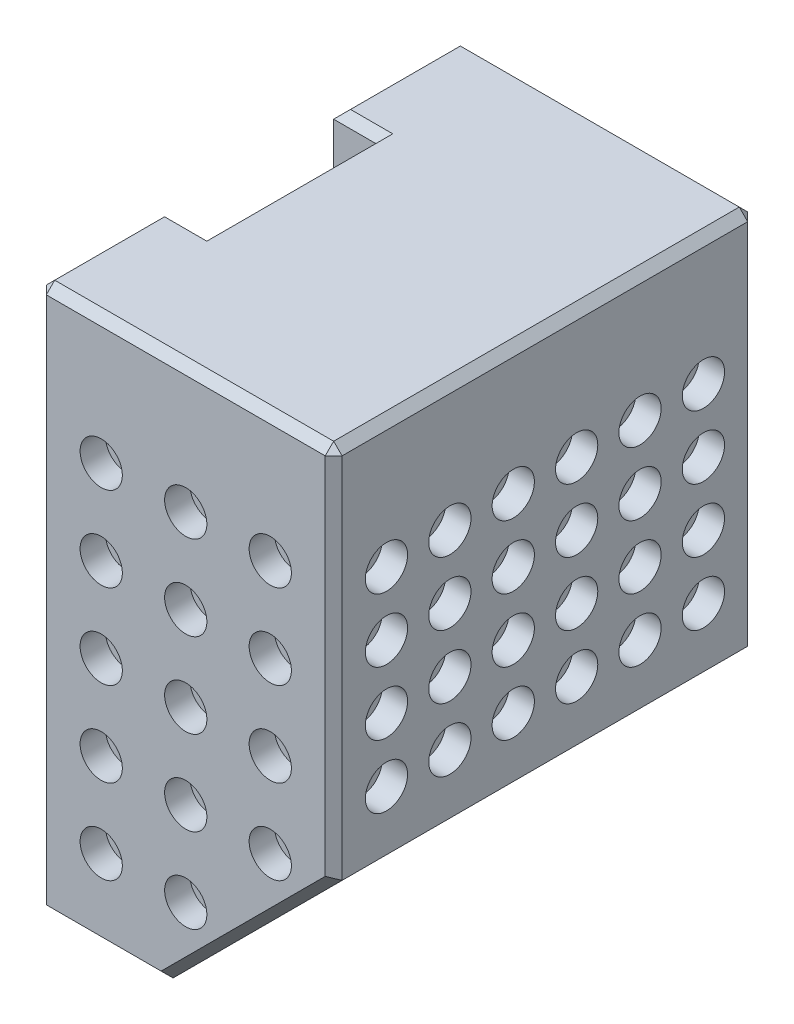
from build123d import *

# Parameters (mm, degrees)
SKETCH1_W            = 35
SKETCH1_H            = 49.99
BOSS_EXTRUDE1_DEPTH  = 64.5
CUT_EXTRUDE1_REACH   = 85.46
CUT_EXTRUDE2_REACH   = 79.524
SKETCH3_W            = 14
SKETCH3_H            = 20
FILLET1_R            = 7
SKETCH4_W            = 5
SKETCH4_H            = 20
CUT_EXTRUDE3_DEPTH   = 43
SKETCH5_W            = 30
SKETCH5_H            = 5
CUT_EXTRUDE4_DEPTH   = 5
FILLET5_R            = 2.5
FILLET6_R            = 2.5
CHAMFER1_SIZE        = 1
SKETCH6_R            = 2.5
CUT_EXTRUDE5_DEPTH   = 3
LPATTERN1_COUNT      = 3
LPATTERN1_PITCH      = 10
LPATTERN1_COUNT_DIR2 = 5
LPATTERN1_PITCH_DIR2 = 10
SKETCH9_R            = 2.5
CUT_EXTRUDE20_DEPTH  = 3
LPATTERN2_COUNT      = 4
LPATTERN2_PITCH      = 7.5
LPATTERN2_COUNT_DIR2 = 6
LPATTERN2_PITCH_DIR2 = 7.5
SKETCH10_R           = 2.5
CUT_EXTRUDE21_DEPTH  = 3
LPATTERN3_COUNT      = 7
LPATTERN3_PITCH      = 7.5
LPATTERN3_COUNT_DIR2 = 2
LPATTERN3_PITCH_DIR2 = 35
SKETCH11_R           = 2.5
CUT_EXTRUDE23_DEPTH  = 3
LPATTERN5_COUNT      = 6
LPATTERN5_PITCH      = 7.5
LPATTERN5_COUNT_DIR2 = 3
LPATTERN5_PITCH_DIR2 = 7.5
CUT_EXTRUDE25_START  = -3
SKETCH18_R           = 2.5
CUT_EXTRUDE25_DEPTH  = 3
LPATTERN7_COUNT      = 3
LPATTERN7_PITCH      = 10
LPATTERN7_COUNT_DIR2 = 5
LPATTERN7_PITCH_DIR2 = 10


with BuildPart() as part:
    # Sketch1 → Boss-Extrude1 (new body)
    with BuildSketch(Plane(origin=(0, 0, 0), x_dir=(1, 0, 0), z_dir=(0, 1, 0))):
        Rectangle(SKETCH1_W, SKETCH1_H)
    extrude(amount=-BOSS_EXTRUDE1_DEPTH)

    # Sketch2 → Cut-Extrude1 (cut, up to next)
    with BuildSketch(Plane.XY.offset(24.995), mode=Mode.PRIVATE) as cut_extrude1_sk1:
        Polygon((-2.5, -64.5), (17.5, -44.5), (17.5, -64.5), align=None)
    cut_extrude1_tool1 = extrude(cut_extrude1_sk1.sketch, amount=-CUT_EXTRUDE1_REACH, mode=Mode.PRIVATE) & part.part
    add(cut_extrude1_tool1.solids().sort_by_distance((10.833333, -57.833333, 24.995))[0], mode=Mode.SUBTRACT)

    # Sketch3 → Cut-Extrude2 (cut, up to next)
    with BuildSketch(Plane.ZY.offset(17.5), mode=Mode.PRIVATE) as cut_extrude2_sk1:
        with Locations((0, -54.5)):
            Rectangle(SKETCH3_W, SKETCH3_H)
    cut_extrude2_tool1 = extrude(cut_extrude2_sk1.sketch, amount=-CUT_EXTRUDE2_REACH, mode=Mode.PRIVATE) & part.part
    add(cut_extrude2_tool1.solids().sort_by_distance((-17.5, -54.5, 0))[0], mode=Mode.SUBTRACT)

    # Fillet1
    fillet1_edges = [part.edges().sort_by_distance(p)[0] for p in [
        (0, -44.5, -7),
        (0, -44.5, 7),
    ]]
    fillet(fillet1_edges, radius=FILLET1_R - 0.0001)  # a hair under: the kernel refuses the full size

    # Sketch4 → Cut-Extrude3 (cut)
    with BuildSketch(Plane(origin=(0, 0, 0), x_dir=(1, 0, 0), z_dir=(0, 1, 0))):
        with Locations((-15, 0)):
            Rectangle(SKETCH4_W, SKETCH4_H)
    extrude(amount=-CUT_EXTRUDE3_DEPTH, mode=Mode.SUBTRACT)

    # Sketch5 → Cut-Extrude4 (cut)
    with BuildSketch(Plane.ZY.offset(17.5)):
        with Locations((0, -40.5)):
            Rectangle(SKETCH5_W, SKETCH5_H)
    extrude(amount=-CUT_EXTRUDE4_DEPTH, mode=Mode.SUBTRACT)

    # Fillet5
    fillet5_edges = [part.edges().sort_by_distance(p)[0] for p in [
        (-15, -38, -15),
        (-15, -43, -15),
    ]]
    fillet(fillet5_edges, radius=FILLET5_R - 0.0001)  # a hair under: the kernel refuses the full size

    # Fillet6
    fillet6_edges = [part.edges().sort_by_distance(p)[0] for p in [
        (-15, -43, 15),
        (-15, -38, 15),
    ]]
    fillet(fillet6_edges, radius=FILLET6_R - 0.0001)  # a hair under: the kernel refuses the full size

    # Chamfer1
    chamfer1_edges = [part.edges().sort_by_distance(p)[0] for p in [
        (-10, -64.5, -24.995),
        (17.5, -22.25, -24.995),
        (17.5, -22.25, 24.995),
        (-10, -64.5, 24.995),
        (7.5, -54.5, -24.995),
        (7.5, -54.5, 24.995),
        (0, 0, 24.995),
        (-17.5, 0, -17.4975),
        (-17.5, 0, 17.4975),
        (0, 0, -24.995),
        (17.5, 0, 0),
        (-15, 0, 10),
        (-12.5, 0, 0),
        (-15, 0, -10),
        (-17.5, -32.25, 24.995),
        (-17.5, -32.25, -24.995),
    ]]
    chamfer(chamfer1_edges, length=CHAMFER1_SIZE)

    # Sketch6 → Cut-Extrude5 (cut)
    with BuildSketch(Plane.XY.offset(24.995)):
        with Locations((-10, -15)):
            Circle(SKETCH6_R)
    cut_extrude5 = extrude(amount=-CUT_EXTRUDE5_DEPTH, mode=Mode.SUBTRACT)

    # LPattern1: Cut-Extrude5 3 × 5, 1 skipped
    with Locations(*[(i * LPATTERN1_PITCH, -j * LPATTERN1_PITCH_DIR2, 0) for i in range(LPATTERN1_COUNT) for j in range(LPATTERN1_COUNT_DIR2) if (i, j) not in ((0, 0), (2, 4))]):
        add(cut_extrude5, mode=Mode.SUBTRACT)

    # Sketch9 → Cut-Extrude20 (cut)
    with BuildSketch(Plane(origin=(17.5, 0, 0), x_dir=(0, 0, -1), z_dir=(1, 0, 0))):
        with Locations((-18.745, -15)):
            Circle(SKETCH9_R)
    cut_extrude20 = extrude(amount=-CUT_EXTRUDE20_DEPTH, mode=Mode.SUBTRACT)

    # LPattern2: Cut-Extrude20 4 × 6
    with Locations(*[(0, -i * LPATTERN2_PITCH, -j * LPATTERN2_PITCH_DIR2) for i in range(LPATTERN2_COUNT) for j in range(LPATTERN2_COUNT_DIR2) if (i, j) != (0, 0)]):
        add(cut_extrude20, mode=Mode.SUBTRACT)

    # Sketch10 → Cut-Extrude21 (cut)
    with BuildSketch(Plane.ZY.offset(17.5)):
        with Locations((-16.9975, -15)):
            Circle(SKETCH10_R)
    cut_extrude21 = extrude(amount=-CUT_EXTRUDE21_DEPTH, mode=Mode.SUBTRACT)

    # LPattern3: Cut-Extrude21 7 × 2
    with Locations(*[(0, -i * LPATTERN3_PITCH, j * LPATTERN3_PITCH_DIR2) for i in range(LPATTERN3_COUNT) for j in range(LPATTERN3_COUNT_DIR2) if (i, j) != (0, 0)]):
        add(cut_extrude21, mode=Mode.SUBTRACT)

    # Sketch11 → Cut-Extrude23 (cut)
    with BuildSketch(Plane(origin=(31, -31, 0), x_dir=(0, 0, -1), z_dir=(0.707106781186544, -0.7071067811865511, 0))):
        with Locations(Location((-18.745, -26.591883092, 0), (0, 0, 90))):
            Circle(SKETCH11_R)
    cut_extrude23 = extrude(amount=-CUT_EXTRUDE23_DEPTH, mode=Mode.SUBTRACT)

    # LPattern5: Cut-Extrude23 6 × 3, 6 skipped
    with Locations(*[Vector(0, 0, -1) * (i * LPATTERN5_PITCH) + Vector(-0.707106781186551, -0.707106781186544, 0) * (j * LPATTERN5_PITCH_DIR2) for i in range(LPATTERN5_COUNT) for j in range(LPATTERN5_COUNT_DIR2) if (i, j) not in ((0, 0), (2, 0), (2, 1), (2, 2), (3, 0), (3, 1), (3, 2))]):
        add(cut_extrude23, mode=Mode.SUBTRACT)

    # Sketch18 → Cut-Extrude25 (cut)
    with BuildSketch(Plane(origin=(0, 0, -24.995), x_dir=(-1, 0, 0), z_dir=(0, 0, -1)).offset(CUT_EXTRUDE25_START)):
        with Locations(Location((10, -15, 0), (0, 0, 180))):
            Circle(SKETCH18_R)
    cut_extrude25 = extrude(amount=CUT_EXTRUDE25_DEPTH, mode=Mode.SUBTRACT)

    # LPattern7: Cut-Extrude25 3 × 5
    with Locations(*[(i * LPATTERN7_PITCH, -j * LPATTERN7_PITCH_DIR2, 0) for i in range(LPATTERN7_COUNT) for j in range(LPATTERN7_COUNT_DIR2) if (i, j) != (0, 0)]):
        add(cut_extrude25, mode=Mode.SUBTRACT)


solid = part.part
